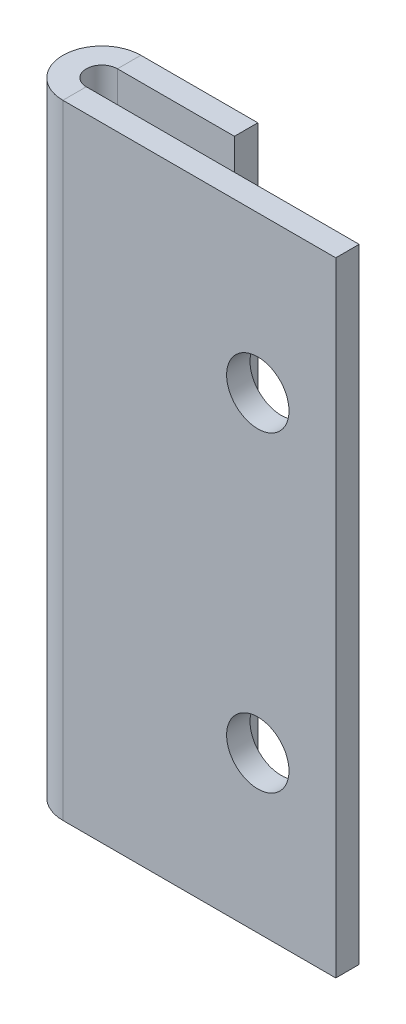
from build123d import *

# Parameters (mm, degrees)
SKETCH_1_W             = 20
SKETCH_1_H             = 40
SKETCH_1_R             = 2
SM_BASE_FLANGE_1_DEPTH = 1.5
OTHER_START            = -20
OTHER_1_DEPTH          = 40
OTHER_1_2_DEPTH        = 40


# Read off the part's stored shape, not the designer's step: 褶边1
# Sheet-metal steps are written as plain solids
with BuildPart() as part:
    # Sketch 1 → 基体-法兰1 (new body)
    with BuildSketch(Plane.XY):
        Rectangle(SKETCH_1_W, SKETCH_1_H)
        with Locations((5, 10)):
            Circle(SKETCH_1_R, mode=Mode.SUBTRACT)
        with Locations((5, -10)):
            Circle(SKETCH_1_R, mode=Mode.SUBTRACT)
    extrude(amount=-SM_BASE_FLANGE_1_DEPTH)

    # Other 1 outline → Other 1 (cut)
    with BuildSketch(Plane(origin=(0, 0, 0), x_dir=(1, 0, 0), z_dir=(0, 1, 0)).offset(OTHER_START)):
        with BuildLine():
            ThreePointArc((-7.5, 0), (-8.869306394, 0.408349934), (-9.791287847, 1.5))
            Line((-9.791287847, 1.5), (-10, 1.5))
            Line((-10, 1.5), (-10, 0))
            Line((-10, 0), (-7.5, 0))
        make_face()
    extrude(amount=OTHER_1_DEPTH, mode=Mode.SUBTRACT)

    # Other 1 2 outline → Other 1 2 (add)
    with BuildSketch(Plane(origin=(0, 0, 0), x_dir=(1, 0, 0), z_dir=(0, 1, 0)).offset(OTHER_START)):
        with BuildLine():
            Line((0, 3.5), (0, 5))
            Line((0, 5), (-7.5, 5))
            ThreePointArc((-7.5, 5), (-9.591650066, 3.869306394), (-9.791287847, 1.5))
            Line((-9.791287847, 1.5), (-7.5, 1.5))
            ThreePointArc((-7.5, 1.5), (-8.5, 2.5), (-7.5, 3.5))
            Line((-7.5, 3.5), (0, 3.5))
        make_face()
    extrude(amount=OTHER_1_2_DEPTH)


solid = part.part
